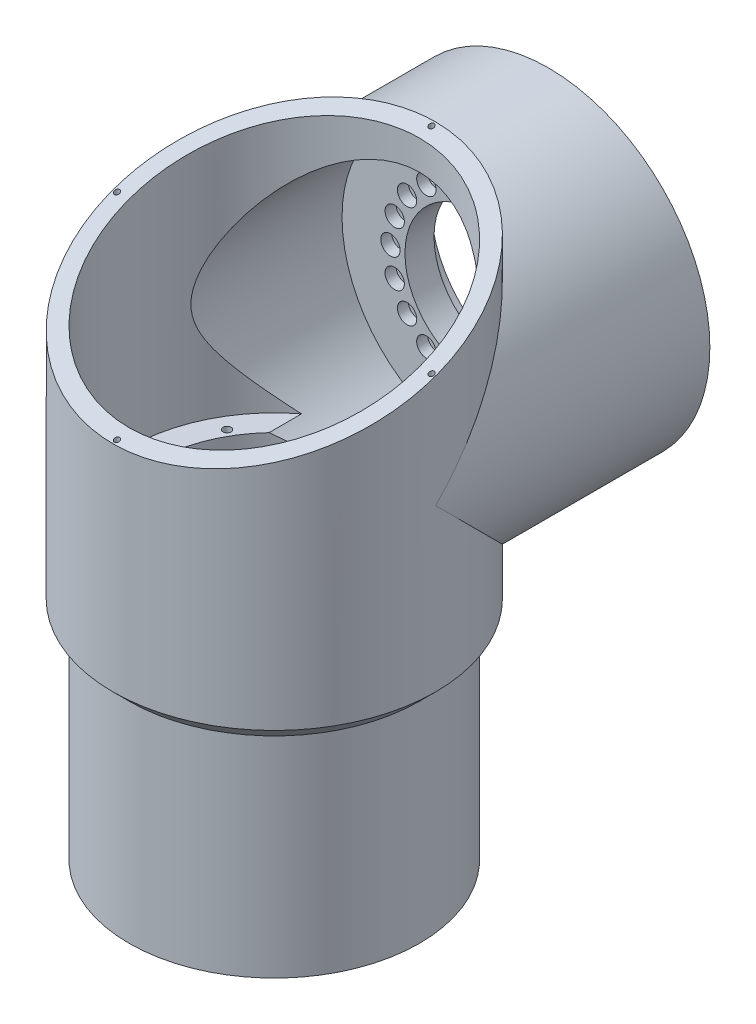
from build123d import *

# Parameters (mm, degrees)
SKETCH_1_R                = 50
EXTRUDE_1_DEPTH           = 85
EXTRUDE_2_DEPTH           = 53
EXTRUDE_2_DEPTH_BACK      = 120
SKETCH_2_R                = 50
SKETCH_3_R                = 42
CUT_EXTRUDE_1_DEPTH       = 4.5
SKETCH_4_R                = 32
CUT_EXTRUDE_2_DEPTH       = 8.5
SKETCH_5_R                = 37
CUT_EXTRUDE_3_DEPTH       = 20.5
SKETCH_6_OUTSIDE_W        = 150.23
SKETCH_6_OUTSIDE_H        = 185.23
SKETCH_6_OUTSIDE_R        = 45
CUT_EXTRUDE_4_DEPTH       = 65
CHAMFER_1_SIZE            = 5
PATTERN_CIRCULAR_1_COUNT  = 12
SKETCH_9_R                = 20
CUT_EXTRUDE_5_DEPTH       = 210.717071313
SKETCH_10_R               = 37.5
CUT_EXTRUDE_6_DEPTH       = 142.5
CUT_EXTRUDE_START         = -84.9
SKETCH_11_R               = 45
CUT_EXTRUDE_7_DEPTH       = 84.9
SKETCH_15_R               = 22.5
CUT_EXTRUDE_8_DEPTH       = 20
SKETCH_17_R               = 42
CUT_EXTRUDE_9_DEPTH       = 50
HOLE_WIZARD_1_D           = 3.6
HOLE_WIZARD_1_DEPTH       = 22
HOLE_WIZARD_1_CBORE_D     = 6
HOLE_WIZARD_1_CBORE_DEPTH = 3.4
PATTERN_CIRCULAR_3_COUNT  = 20
CUT_EXTRUDE_10_DEPTH      = 188.41664814
CUT_EXTRUDE_10_DEPTH_BACK = 188.41664814
PATTERN_CIRCULAR_4_COUNT  = 5
PATTERN_CIRCULAR_4_ANGLE  = 120
SKETCH_25_R               = 0.8
CUT_EXTRUDE_11_DEPTH      = 47
SKETCH_26_R               = 0.8
CUT_EXTRUDE_12_DEPTH      = 25
SKETCH_27_R               = 0.8
CUT_EXTRUDE_13_DEPTH      = 5


with BuildPart() as part:
    # 草图1 → 凸台-拉伸1 (new body)
    with BuildSketch(Plane.XY):
        Circle(SKETCH_1_R)
    extrude(amount=EXTRUDE_1_DEPTH)

    # 草图2 → 凸台-拉伸2 (add, two sides: drawn at the far end of the back side and taken through both)
    with BuildSketch(Plane(origin=(0, 0, 0), x_dir=(1, 0, 0), z_dir=(0, 1, 0)).offset(-EXTRUDE_2_DEPTH_BACK)):
        with Locations(Location((0, -85, 0), (0, 0, 270))):
            Circle(SKETCH_2_R)
    extrude(amount=EXTRUDE_2_DEPTH + EXTRUDE_2_DEPTH_BACK)

    # 草图3 → 切除-拉伸1 (cut)
    with BuildSketch(Plane(origin=(0, 0, 0), x_dir=(-1, 0, 0), z_dir=(0, 0, -1))):
        Circle(SKETCH_3_R)
    extrude(amount=-CUT_EXTRUDE_1_DEPTH, mode=Mode.SUBTRACT)

    # 草图4 → 切除-拉伸2 (cut)
    with BuildSketch(Plane(origin=(0, 0, 4.5), x_dir=(-1, 0, 0), z_dir=(0, 0, -1))):
        Circle(SKETCH_4_R)
    extrude(amount=-CUT_EXTRUDE_2_DEPTH, mode=Mode.SUBTRACT)

    # 草图5 → 切除-拉伸3 (cut)
    with BuildSketch(Plane.XZ.offset(120)):
        with Locations(Location((0, 85, 0), (0, 0, 270))):
            Circle(SKETCH_5_R)
    extrude(amount=-CUT_EXTRUDE_3_DEPTH, mode=Mode.SUBTRACT)

    # 草图6 outside → 切除-拉伸4 (cut)
    with BuildSketch(Plane.XZ.offset(120)):
        with Locations((0, 67.5)):
            Rectangle(SKETCH_6_OUTSIDE_W, SKETCH_6_OUTSIDE_H)
        with Locations(Location((0, 85, 0), (0, 0, 270))):
            Circle(SKETCH_6_OUTSIDE_R, mode=Mode.SUBTRACT)
    extrude(amount=-CUT_EXTRUDE_4_DEPTH, mode=Mode.SUBTRACT)

    # 倒角1
    chamfer_1_edges = [part.edges().sort_by_distance(p)[0] for p in [
        (0, -55, 35),
    ]]
    chamfer(chamfer_1_edges, length=CHAMFER_1_SIZE - 0.0001)  # a hair under: the kernel refuses the full size

    # 草图7 → M3 螺纹孔1 (revolve, cut)
    with BuildSketch(Plane(origin=(0, -99.5, 117), x_dir=(0, 0, -1), z_dir=(1, 0, 0))):
        Polygon((0, 0), (0, 8.251075774), (1.25, 7.5), (1.25, 0), align=None)
    hole_wizard_m3_1 = revolve(axis=Axis((0, -105.85, 117), (0, 1, 0)), mode=Mode.SUBTRACT)

    # 阵列(圆周)1: M3 螺纹孔1 ×12 about axis
    pattern_circular_1_axis = Axis((0, 0, 85), (0, 1, 0))
    for i in range(1, PATTERN_CIRCULAR_1_COUNT):
        add(hole_wizard_m3_1.rotate(pattern_circular_1_axis, i * 360 / PATTERN_CIRCULAR_1_COUNT), mode=Mode.SUBTRACT)

    # 草图9 → 切除-拉伸5 (cut, through all)
    with BuildSketch(Plane.XZ.offset(99.5)):
        with Locations(Location((0, 85, 0), (0, 0, 270))):
            Circle(SKETCH_9_R)
    extrude(amount=-CUT_EXTRUDE_5_DEPTH, mode=Mode.SUBTRACT)

    # 草图10 → 切除-拉伸6 (cut)
    with BuildSketch(Plane(origin=(0, 53, 0), x_dir=(1, 0, 0), z_dir=(0, 1, 0))):
        with Locations(Location((0, -85, 0), (0, 0, 270))):
            Circle(SKETCH_10_R)
    extrude(amount=-CUT_EXTRUDE_6_DEPTH, mode=Mode.SUBTRACT)

    # 草图11 → 切除-拉伸7 (cut)
    with BuildSketch(Plane(origin=(0, 53, 0), x_dir=(1, 0, 0), z_dir=(0, 1, 0)).offset(CUT_EXTRUDE_START)):
        with Locations(Location((0, -85, 0), (0, 0, 90))):
            Circle(SKETCH_11_R)
    extrude(amount=CUT_EXTRUDE_7_DEPTH, mode=Mode.SUBTRACT)

    # 草图15 → 切除-拉伸8 (cut)
    with BuildSketch(Plane(origin=(0, 0, 13), x_dir=(-1, 0, 0), z_dir=(0, 0, -1))):
        Circle(SKETCH_15_R)
    extrude(amount=-CUT_EXTRUDE_8_DEPTH, mode=Mode.SUBTRACT)

    # 草图17 → 切除-拉伸9 (cut)
    with BuildSketch(Plane.XY.offset(22)):
        with Locations(Location((0, 0, 0), (0, 0, 180))):
            Circle(SKETCH_17_R)
    extrude(amount=CUT_EXTRUDE_9_DEPTH, mode=Mode.SUBTRACT)

    # 打孔尺寸(%根据)内六角圆柱头螺钉的类型1
    with Locations(Plane.XY.offset(22)):
        with Locations((-27, 0)):
            hole_wizard_1 = CounterBoreHole(HOLE_WIZARD_1_D / 2, HOLE_WIZARD_1_CBORE_D / 2, HOLE_WIZARD_1_CBORE_DEPTH, depth=HOLE_WIZARD_1_DEPTH)

    # 阵列(圆周)3: 打孔尺寸(%根据)内六角圆柱头螺钉的类型1 ×20 about axis
    pattern_circular_3_axis = Axis((0, 0, 0), (0, 0, 1))
    for i in range(1, PATTERN_CIRCULAR_3_COUNT):
        add(hole_wizard_1.rotate(pattern_circular_3_axis, i * 360 / PATTERN_CIRCULAR_3_COUNT), mode=Mode.SUBTRACT)

    # 草图22 → 切除-拉伸10 (cut, two sides: drawn at the far end of the back side and taken through both)
    with BuildSketch(Plane(origin=(0, 0, 0), x_dir=(0, 0, -1), z_dir=(1, 0, 0)).offset(-CUT_EXTRUDE_10_DEPTH_BACK)):
        Polygon((-35, 53), (-135, 53), (-135, 16.602976573), align=None)
    extrude(amount=CUT_EXTRUDE_10_DEPTH + CUT_EXTRUDE_10_DEPTH_BACK, mode=Mode.SUBTRACT)

    # 草图23 → M3 螺纹孔3 (revolve, cut)
    with BuildSketch(Plane(origin=(0, -31.9, 125), x_dir=(0, 0, 1), z_dir=(1, 0, 0))):
        Polygon((0, 0), (0, 8.251075774), (1.25, 7.5), (1.25, 0), align=None)
    hole_wizard_m3_3 = revolve(axis=Axis((0, -25.55, 125), (0, -1, 0)), mode=Mode.SUBTRACT)

    # 阵列(圆周)4: M3 螺纹孔3 ×5 about axis
    pattern_circular_4_axis = Axis((0, 0, 85), (0, 1, 0))
    for i in range(1, PATTERN_CIRCULAR_4_COUNT):
        add(hole_wizard_m3_3.rotate(pattern_circular_4_axis, i * PATTERN_CIRCULAR_4_ANGLE / (PATTERN_CIRCULAR_4_COUNT - 1)), mode=Mode.SUBTRACT)

    # 镜向1 copy 1 sketch → 镜向1 copy 1 (revolve, cut)
    with BuildSketch(Plane(origin=(-20, -31.9, 119.641016151), x_dir=(-0.5000000000000011, 0, 0.866025403784438), z_dir=(-0.866025403784438, 0, -0.5000000000000011))):
        Polygon((0, 0), (0, -8.251075774), (1.25, -7.5), (1.25, 0), align=None)
    revolve(axis=Axis((-20, -25.55, 119.641016151), (0, 1, 0)), mode=Mode.SUBTRACT)

    # 镜向1 copy 2 sketch → 镜向1 copy 2 (revolve, cut)
    with BuildSketch(Plane(origin=(-34.641016151, -31.9, 105), x_dir=(-0.8660254037844399, 0, 0.4999999999999978), z_dir=(-0.4999999999999978, 0, -0.8660254037844399))):
        Polygon((0, 0), (0, -8.251075774), (1.25, -7.5), (1.25, 0), align=None)
    revolve(axis=Axis((-34.641016151, -25.55, 105), (0, 1, 0)), mode=Mode.SUBTRACT)

    # 镜向1 copy 3 sketch → 镜向1 copy 3 (revolve, cut)
    with BuildSketch(Plane(origin=(-40, -31.9, 85), x_dir=(-1, 0, 0), z_dir=(0, 0, -1))):
        Polygon((0, 0), (0, -8.251075774), (1.25, -7.5), (1.25, 0), align=None)
    revolve(axis=Axis((-40, -25.55, 85), (0, 1, 0)), mode=Mode.SUBTRACT)

    # 镜向1 copy 4 sketch → 镜向1 copy 4 (revolve, cut)
    with BuildSketch(Plane(origin=(-34.641016151, -31.9, 65), x_dir=(-0.866025403784436, 0, -0.5000000000000044), z_dir=(0.5000000000000044, 0, -0.866025403784436))):
        Polygon((0, 0), (0, -8.251075774), (1.25, -7.5), (1.25, 0), align=None)
    revolve(axis=Axis((-34.641016151, -25.55, 65), (0, 1, 0)), mode=Mode.SUBTRACT)

    # 镜向1 copy 5 sketch → 镜向1 copy 5 (revolve, cut)
    with BuildSketch(Plane(origin=(0, -31.9, 125), x_dir=(0, 0, 1), z_dir=(-1, 0, 0))):
        Polygon((0, 0), (0, -8.251075774), (1.25, -7.5), (1.25, 0), align=None)
    revolve(axis=Axis((0, -25.55, 125), (0, 1, 0)), mode=Mode.SUBTRACT)

    # 草图25 → 切除-拉伸11 (cut)
    with BuildSketch(Plane(origin=(0, 53, 0), x_dir=(1, 0, 0), z_dir=(0, 1, 0))):
        with Locations(Location((0, -133.75, 0), (0, 0, 270))):
            Circle(SKETCH_25_R)
    extrude(amount=-CUT_EXTRUDE_11_DEPTH, mode=Mode.SUBTRACT)

    # 草图26 → 切除-拉伸12 (cut)
    with BuildSketch(Plane(origin=(0, 53, 0), x_dir=(1, 0, 0), z_dir=(0, 1, 0))):
        with Locations(Location((-48.75, -85, 0), (0, 0, 270))):
            Circle(SKETCH_26_R)
        with Locations(Location((48.75, -85, 0), (0, 0, 270))):
            Circle(SKETCH_26_R)
    extrude(amount=-CUT_EXTRUDE_12_DEPTH, mode=Mode.SUBTRACT)

    # 草图27 → 切除-拉伸13 (cut)
    with BuildSketch(Plane(origin=(0, 53, 0), x_dir=(1, 0, 0), z_dir=(0, 1, 0))):
        with Locations(Location((0, -36.25, 0), (0, 0, 270))):
            Circle(SKETCH_27_R)
    extrude(amount=-CUT_EXTRUDE_13_DEPTH, mode=Mode.SUBTRACT)


solid = part.part
